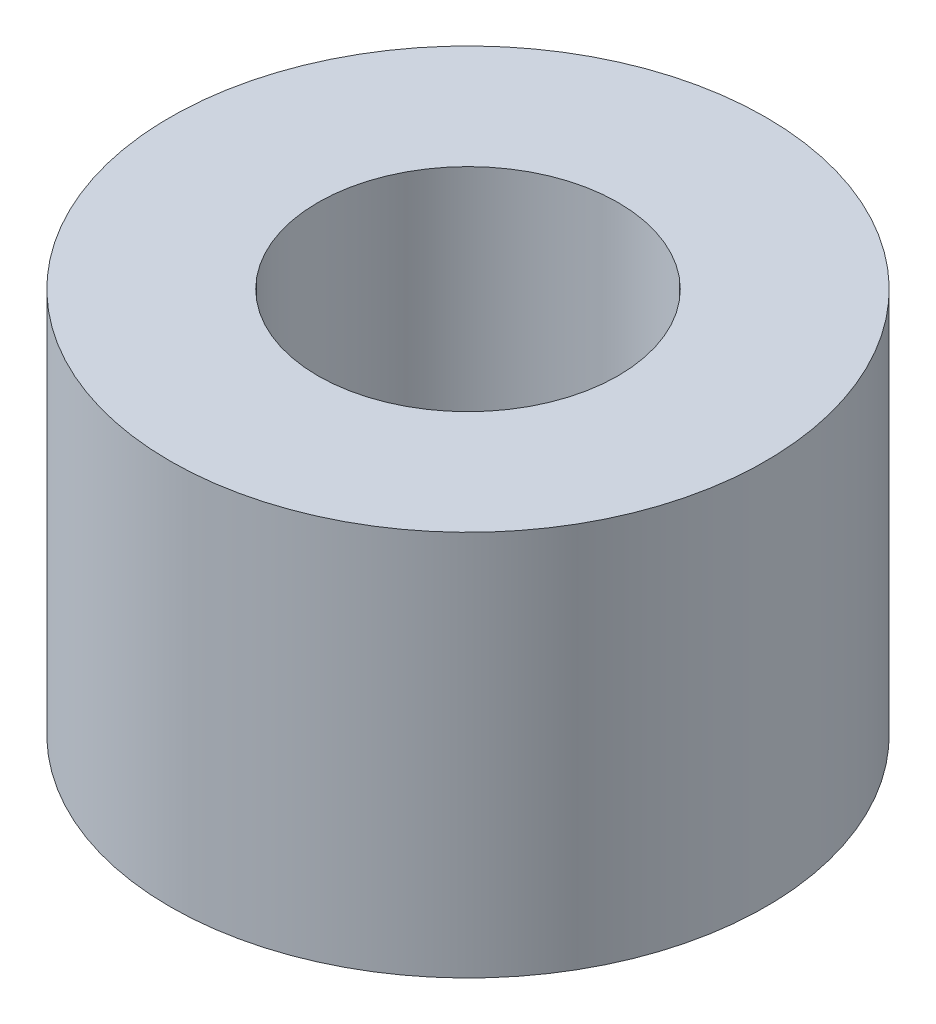
from build123d import *

# Parameters (mm, degrees)
SKETCH1_R           = 15.875
SKETCH1_R_2         = 8.001
BOSS_EXTRUDE1_DEPTH = 10.287


with BuildPart() as part:
    # Sketch1 → Boss-Extrude1 (new, symmetric)
    with BuildSketch(Plane(origin=(0, 0, 0), x_dir=(1, 0, 0), z_dir=(0, 1, 0))):
        Circle(SKETCH1_R)
        Circle(SKETCH1_R_2, mode=Mode.SUBTRACT)
    extrude(amount=BOSS_EXTRUDE1_DEPTH, both=True)


solid = part.part
